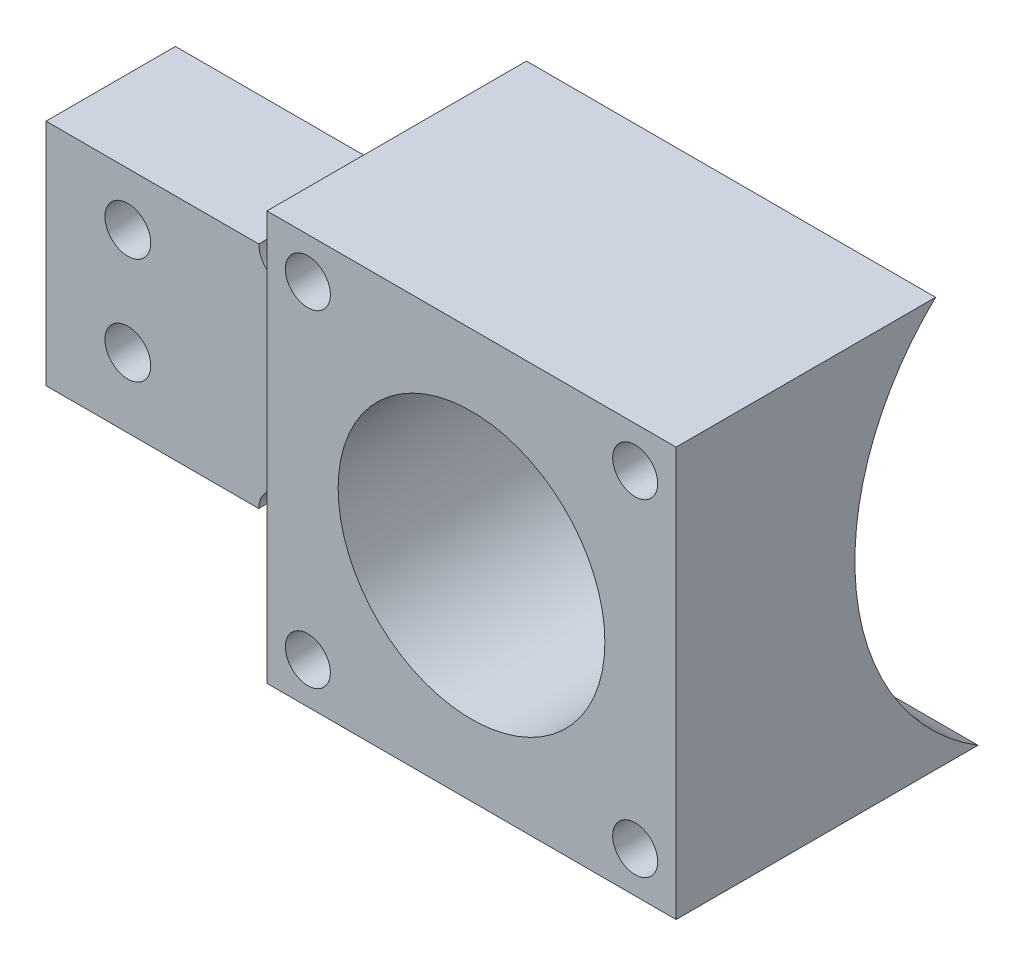
from build123d import *
from build123d.topology import SkipClean

# Parameters (mm, degrees)
SKETCH1_W               = 50
SKETCH1_H               = 50
SKETCH1_R               = 16.3
SKETCH1_R_2             = 2.75
BOSS_EXTRUDE1_DEPTH     = 53.6
CUT_EXTRUDE1_DEPTH      = 66.015075175
CUT_EXTRUDE1_DEPTH_BACK = 66.015075175
SKETCH2_R               = 31.75
BOSS_EXTRUDE3_START     = 35
BOSS_EXTRUDE3_DEPTH     = 35
SKETCH12_W              = 35
SKETCH12_H              = 28
CUT_EXTRUDE7_DEPTH      = 8
SKETCH9_R               = 3
CUT_EXTRUDE5_DEPTH      = 85.864362462
CUT_EXTRUDE6_START      = -10
SKETCH10_R              = 2.8
CUT_EXTRUDE6_DEPTH      = 82.860361661
CUT_EXTRUDE8_DEPTH      = 72.860361661


with BuildPart() as part:
    # Sketch1 → Boss-Extrude1 (new body)
    with BuildSketch(Plane.XY):
        with Locations((0, -2)):
            Rectangle(SKETCH1_W, SKETCH1_H)
        with Locations((0, -2)):
            Circle(SKETCH1_R, mode=Mode.SUBTRACT)
        with Locations((-20, 18)):
            Circle(SKETCH1_R_2, mode=Mode.SUBTRACT)
        with Locations((20, 18)):
            Circle(SKETCH1_R_2, mode=Mode.SUBTRACT)
        with Locations((20, -22)):
            Circle(SKETCH1_R_2, mode=Mode.SUBTRACT)
        with Locations((-20, -22)):
            Circle(SKETCH1_R_2, mode=Mode.SUBTRACT)
    extrude(amount=BOSS_EXTRUDE1_DEPTH)

    # Sketch2 → Cut-Extrude1 (cut, two sides: drawn at the far end of the back side and taken through both)
    with BuildSketch(Plane(origin=(0, 0, 0), x_dir=(0, 0, -1), z_dir=(1, 0, 0)).offset(-CUT_EXTRUDE1_DEPTH_BACK)):
        Circle(SKETCH2_R)
    extrude(amount=CUT_EXTRUDE1_DEPTH + CUT_EXTRUDE1_DEPTH_BACK, mode=Mode.SUBTRACT)

    # Sketch4 → Boss-Extrude3 (add)
    with SkipClean():  # the faces are left unmerged after this step: merging them gives an invalid solid
        with BuildSketch(Plane(origin=(25, 0, 0), x_dir=(0, 0, -1), z_dir=(1, 0, 0)).offset(BOSS_EXTRUDE3_START)):
            with BuildLine():
                Line((-53.6, 11), (-53.6, -17))
                Line((-53.6, -17), (-26.815340759, -17))
                ThreePointArc((-26.815340759, -17), (-31.573087709, -3.347033393), (-29.783594477, 11))
                Line((-29.783594477, 11), (-53.6, 11))
            make_face()
        boss_extrude3 = extrude(amount=-BOSS_EXTRUDE3_DEPTH)

    # Sketch12 → Cut-Extrude7 (cut)
    with SkipClean():  # the faces are left unmerged after this step: merging them gives an invalid solid
        with BuildSketch(Plane.XY.offset(53.6)):
            with Locations((42.5, -3)):
                Rectangle(SKETCH12_W, SKETCH12_H)
        cut_extrude7 = extrude(amount=-CUT_EXTRUDE7_DEPTH, mode=Mode.SUBTRACT)

    # Sketch9 → Cut-Extrude5 (cut, symmetric)
    with SkipClean():  # the faces are left unmerged after this step: merging them gives an invalid solid
        with BuildSketch(Plane.XY):
            with Locations((31, 11)):
                Circle(SKETCH9_R)
            with Locations((31, -17)):
                Circle(SKETCH9_R)
        cut_extrude5 = extrude(amount=CUT_EXTRUDE5_DEPTH, both=True, mode=Mode.SUBTRACT)

    # Sketch10 → Cut-Extrude6 (cut)
    with SkipClean():  # the faces are left unmerged after this step: merging them gives an invalid solid
        with BuildSketch(Plane.XY.offset(45.6).offset(CUT_EXTRUDE6_START)):
            with Locations((50, 4.5)):
                Circle(SKETCH10_R)
            with Locations((50, -8.5)):
                Circle(SKETCH10_R)
        cut_extrude6 = extrude(amount=CUT_EXTRUDE6_DEPTH, mode=Mode.SUBTRACT)

    # Mirror3: Boss-Extrude3, Cut-Extrude7, Cut-Extrude5, Cut-Extrude6 across plane
    with SkipClean():  # the faces are left unmerged after this step: merging them gives an invalid solid
        add(boss_extrude3.mirror(Plane(origin=(0, 0, 0), x_dir=(0, 0, 1), z_dir=(1, 0, 0))))
        add(cut_extrude7.mirror(Plane(origin=(0, 0, 0), x_dir=(0, 0, 1), z_dir=(1, 0, 0))), mode=Mode.SUBTRACT)
        add(cut_extrude5.mirror(Plane(origin=(0, 0, 0), x_dir=(0, 0, 1), z_dir=(1, 0, 0))), mode=Mode.SUBTRACT)
        add(cut_extrude6.mirror(Plane(origin=(0, 0, 0), x_dir=(0, 0, 1), z_dir=(1, 0, 0))), mode=Mode.SUBTRACT)

    # Sketch13 → Cut-Extrude8 (cut, through all)
    with SkipClean():  # the faces are left unmerged after this step: merging them gives an invalid solid
        with BuildSketch(Plane.XY.offset(45.6)):
            with BuildLine():
                Line((25, 11), (25, -17))
                Line((25, -17), (28, -17))
                ThreePointArc((28, -17), (31, -14), (34, -17))
                Line((34, -17), (60, -17))
                Line((60, -17), (60, 11))
                Line((60, 11), (34, 11))
                ThreePointArc((34, 11), (31, 8), (28, 11))
                Line((28, 11), (25, 11))
            make_face()
        extrude(amount=-CUT_EXTRUDE8_DEPTH, mode=Mode.SUBTRACT)


solid = part.part
